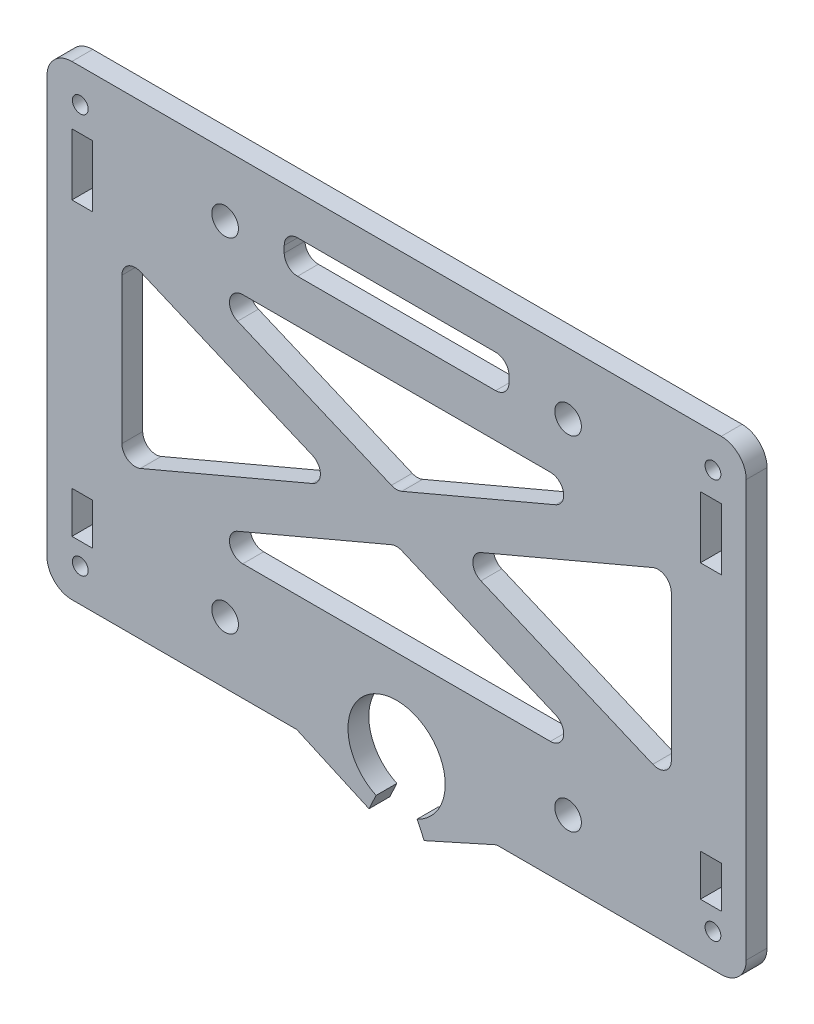
from build123d import *

# Parameters (mm, degrees)
SKETCH1_R           = 0.60325
SKETCH1_R_2         = 1.016
BOSS_EXTRUDE1_DEPTH = 1.5875
SPEED_HOLES_REACH   = 35.53
SKETCH2_W           = 17.145
SKETCH2_H           = 2.54
FILLET1_R           = 1.016
SKETCH5_W           = 1.5875
SKETCH5_H           = 3.175
SKETCH5_H_2         = 4.699
CUT_EXTRUDE1_DEPTH  = 34.530212411


with BuildPart() as part:
    # Sketch1 → Boss-Extrude1 (new body)
    with BuildSketch(Plane.XY):
        with BuildLine():
            ThreePointArc((26.67, 15.875), (26.112038418, 17.222038418), (24.765, 17.78))
            Line((24.765, 17.78), (-24.765, 17.78))
            ThreePointArc((-24.765, 17.78), (-26.112038418, 17.222038418), (-26.67, 15.875))
            Line((-26.67, 15.875), (-26.67, -15.875))
            ThreePointArc((-26.67, -15.875), (-26.112038418, -17.222038418), (-24.765, -17.78))
            Line((-24.765, -17.78), (-7.62, -17.78))
            Line((-7.62, -17.78), (-2.103962754, -20.259962687))
            Line((-2.103962754, -20.259962687), (-1.567237562, -19.108951797))
            ThreePointArc((-1.567237562, -19.108951797), (0, -12.0396), (1.567237562, -19.108951797))
            Line((1.567237562, -19.108951797), (2.103962754, -20.259962687))
            Line((2.103962754, -20.259962687), (7.62, -17.78))
            Line((7.62, -17.78), (24.765, -17.78))
            ThreePointArc((24.765, -17.78), (26.112038418, -17.222038418), (26.67, -15.875))
            Line((26.67, -15.875), (26.67, 15.875))
        make_face()
        with Locations((-24.13, -15.24)):
            Circle(SKETCH1_R, mode=Mode.SUBTRACT)
        with Locations((-13.08, -13.08)):
            Circle(SKETCH1_R_2, mode=Mode.SUBTRACT)
        with Locations((13.08, -13.08)):
            Circle(SKETCH1_R_2, mode=Mode.SUBTRACT)
        with Locations((24.13, -15.24)):
            Circle(SKETCH1_R, mode=Mode.SUBTRACT)
        with Locations((-24.13, 15.24)):
            Circle(SKETCH1_R, mode=Mode.SUBTRACT)
        with Locations((-13.08, 13.08)):
            Circle(SKETCH1_R_2, mode=Mode.SUBTRACT)
        with Locations((13.08, 13.08)):
            Circle(SKETCH1_R_2, mode=Mode.SUBTRACT)
        with Locations((24.13, 15.24)):
            Circle(SKETCH1_R, mode=Mode.SUBTRACT)
    extrude(amount=BOSS_EXTRUDE1_DEPTH)

    # Sketch2 → Speed Holes (cut, up to next)
    with BuildSketch(Plane.XY.offset(1.5875), mode=Mode.PRIVATE) as speed_holes_sk1:
        Polygon((4.227373313, 0), (20.955, -7.096568898), (20.955, 7.096568898), align=None)
    speed_holes_tool1 = extrude(speed_holes_sk1.sketch, amount=-SPEED_HOLES_REACH, mode=Mode.PRIVATE) & part.part
    # Sketch2 → Speed Holes (cut, up to next)
    with BuildSketch(Plane.XY.offset(1.5875), mode=Mode.PRIVATE) as speed_holes_sk2:
        Polygon((-16.727626687, 8.89), (0, 1.793431102), (16.727626687, 8.89), align=None)
    speed_holes_tool2 = extrude(speed_holes_sk2.sketch, amount=-SPEED_HOLES_REACH, mode=Mode.PRIVATE) & part.part
    # Sketch2 → Speed Holes (cut, up to next)
    with BuildSketch(Plane.XY.offset(1.5875), mode=Mode.PRIVATE) as speed_holes_sk3:
        Polygon((16.727626687, -8.89), (0, -1.793431102), (-16.727626687, -8.89), align=None)
    speed_holes_tool3 = extrude(speed_holes_sk3.sketch, amount=-SPEED_HOLES_REACH, mode=Mode.PRIVATE) & part.part
    # Sketch2 → Speed Holes (cut, up to next)
    with BuildSketch(Plane.XY.offset(1.5875), mode=Mode.PRIVATE) as speed_holes_sk4:
        Polygon((-20.955, -7.096568898), (-4.227373313, 0), (-20.955, 7.096568898), align=None)
    speed_holes_tool4 = extrude(speed_holes_sk4.sketch, amount=-SPEED_HOLES_REACH, mode=Mode.PRIVATE) & part.part
    # Sketch2 → Speed Holes (cut, up to next)
    with BuildSketch(Plane.XY.offset(1.5875), mode=Mode.PRIVATE) as speed_holes_sk5:
        with Locations((0, 13.462)):
            Rectangle(SKETCH2_W, SKETCH2_H)
    speed_holes_tool5 = extrude(speed_holes_sk5.sketch, amount=-SPEED_HOLES_REACH, mode=Mode.PRIVATE) & part.part
    add(speed_holes_tool1.solids().sort_by_distance((15.379124, 0, 1.5875))[0], mode=Mode.SUBTRACT)
    add(speed_holes_tool2.solids().sort_by_distance((0, 6.524477, 1.5875))[0], mode=Mode.SUBTRACT)
    add(speed_holes_tool3.solids().sort_by_distance((0, -6.524477, 1.5875))[0], mode=Mode.SUBTRACT)
    add(speed_holes_tool4.solids().sort_by_distance((-15.379124, 0, 1.5875))[0], mode=Mode.SUBTRACT)
    add(speed_holes_tool5.solids().sort_by_distance((0, 13.462, 1.5875))[0], mode=Mode.SUBTRACT)

    # Fillet1
    fillet1_edges = [part.edges().sort_by_distance(p)[0] for p in [
        (-16.727626687, -8.89, 0.79375),
        (-20.955, -7.096568898, 0.79375),
        (0, 1.793431102, 0.79375),
        (16.727626687, -8.89, 0.79375),
        (20.955, -7.096568898, 0.79375),
        (20.955, 7.096568898, 0.79375),
        (-4.227373313, 0, 0.79375),
        (16.727626687, 8.89, 0.79375),
        (4.227373313, 0, 0.79375),
        (-16.727626687, 8.89, 0.79375),
        (0, -1.793431102, 0.79375),
        (-20.955, 7.096568898, 0.79375),
        (-8.5725, 14.732, 0.79375),
        (-8.5725, 12.192, 0.79375),
        (8.5725, 14.732, 0.79375),
        (8.5725, 12.192, 0.79375),
    ]]
    fillet(fillet1_edges, radius=FILLET1_R)

    # Sketch5 → Cut-Extrude1 (cut, through all)
    with BuildSketch(Plane.XY.offset(1.5875)):
        with Locations((23.97125, -12.006981465)):
            Rectangle(SKETCH5_W, SKETCH5_H)
        with Locations((23.97125, 10.980018535)):
            Rectangle(SKETCH5_W, SKETCH5_H_2)
    cut_extrude1 = extrude(amount=-CUT_EXTRUDE1_DEPTH, mode=Mode.SUBTRACT)

    # Mirror1: Cut-Extrude1 across plane
    add(cut_extrude1.mirror(Plane(origin=(0, 0, 0), x_dir=(0, 0, 1), z_dir=(1, 0, 0))), mode=Mode.SUBTRACT)


solid = part.part
